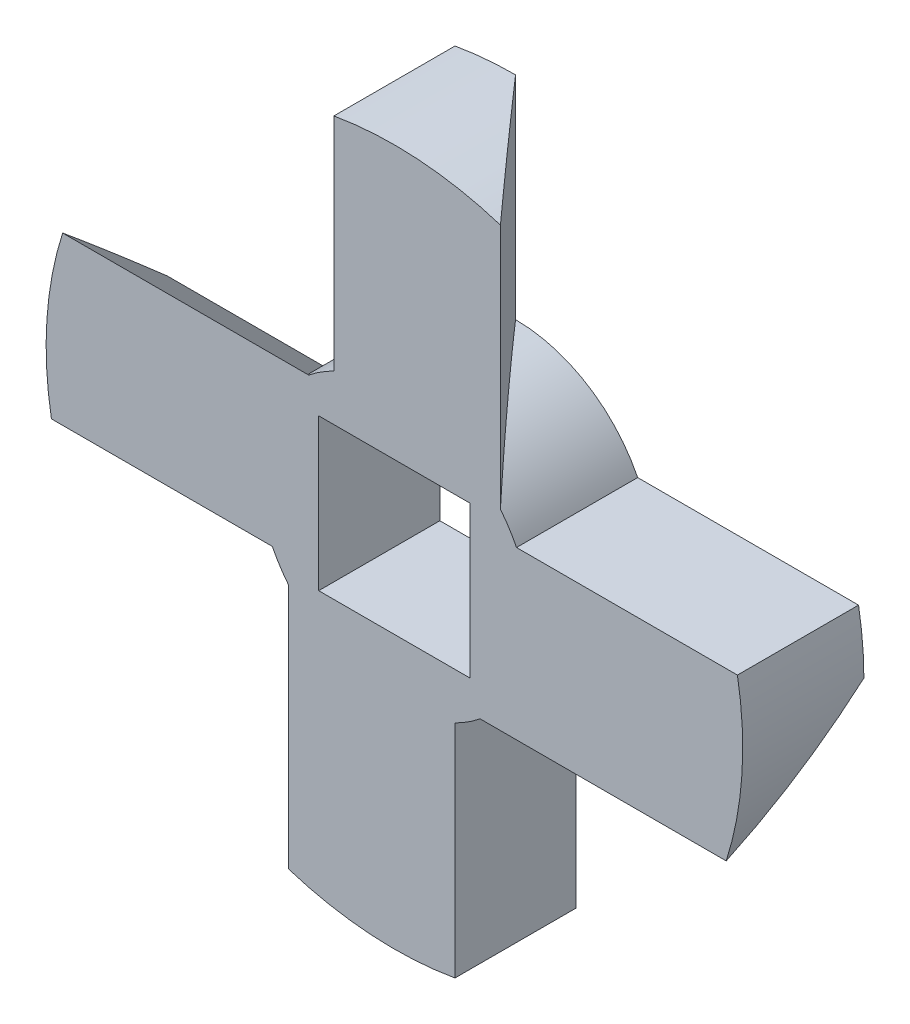
from build123d import *

# Parameters (mm, degrees)
SKETCH1_R               = 9
SKETCH1_W               = 10
SKETCH1_H               = 10
BOSS_EXTRUDE1_DEPTH     = 4
BOSS_EXTRUDE2_START     = -28
BOSS_EXTRUDE2_DEPTH     = 31.343146
CIRPATTERN1_START       = -37
CIRPATTERN1_DEPTH       = 31.343145751
CIRPATTERN1_START_2     = 5.656854249
CIRPATTERN1_2_DEPTH     = 31.343145751
CIRPATTERN1_3_OUTLINE_W = 28
CIRPATTERN1_3_OUTLINE_H = 8
CIRPATTERN1_3_DEPTH     = 4
CIRPATTERN1_START_3     = -4
CIRPATTERN1_4_DEPTH     = 8
CIRPATTERN1_START_4     = 9
CIRPATTERN1_5_DEPTH     = 28
CUT_EXTRUDE1_START      = -4
SKETCH7_R               = 40
SKETCH7_R_2             = 23
CUT_EXTRUDE1_DEPTH      = 8
BOSS_EXTRUDE3_REACH     = 41.611


with BuildPart() as part:
    # Sketch1 → Boss-Extrude1 (new, symmetric)
    with BuildSketch(Plane.XY):
        Circle(SKETCH1_R)
        Rectangle(SKETCH1_W, SKETCH1_H, mode=Mode.SUBTRACT)
    extrude(amount=BOSS_EXTRUDE1_DEPTH, both=True)

    # Sketch4 → Boss-Extrude2 (add)
    with BuildSketch(Plane(origin=(-9, 0, 0), x_dir=(0, 0, -1), z_dir=(1, 0, 0)).offset(BOSS_EXTRUDE2_START)):
        Polygon((4, 0), (4, -4), (-4, -4), (-4, 7), align=None)
    extrude(amount=BOSS_EXTRUDE2_DEPTH)

    # CirPattern1: read off the stored shape, not the designer's step
    # CirPattern1 outline → CirPattern1 (add)
    with BuildSketch(Plane(origin=(0, 0, 0), x_dir=(1, 0, 0), z_dir=(0, 1, 0)).offset(CIRPATTERN1_START)):
        Polygon((-7, -4), (4, -4), (4, 4), (0, 4), align=None)
    extrude(amount=CIRPATTERN1_DEPTH)

    # CirPattern1 2 outline → CirPattern1 2 (add)
    with BuildSketch(Plane(origin=(0, 0, 0), x_dir=(1, 0, 0), z_dir=(0, 1, 0)).offset(CIRPATTERN1_START_2)):
        Polygon((-4, -4), (7, -4), (0, 4), (-4, 4), align=None)
    extrude(amount=CIRPATTERN1_2_DEPTH)

    # CirPattern1 3 outline → CirPattern1 3 (add)
    with BuildSketch(Plane(origin=(0, 0, 0), x_dir=(1, 0, 0), z_dir=(0, 1, 0))):
        with Locations((23, 0)):
            Rectangle(CIRPATTERN1_3_OUTLINE_W, CIRPATTERN1_3_OUTLINE_H)
    extrude(amount=CIRPATTERN1_3_DEPTH)

    # CirPattern1 4 outline → CirPattern1 4 (add)
    with BuildSketch(Plane.XY.offset(CIRPATTERN1_START_3)):
        with BuildLine():
            ThreePointArc((8.062257749, 4), (8.76242888, 2.054224947), (9, 0))
            Line((9, 0), (9, 4))
            Line((9, 4), (8.062257749, 4))
        make_face()
    extrude(amount=CIRPATTERN1_4_DEPTH)

    # CirPattern1 5 outline → CirPattern1 5 (add)
    with BuildSketch(Plane.YZ.offset(CIRPATTERN1_START_4)):
        Polygon((0, -4), (0, 4), (-7, 4), align=None)
    extrude(amount=CIRPATTERN1_5_DEPTH)

    # Sketch7 → Cut-Extrude1 (cut)
    with BuildSketch(Plane.XY.offset(CUT_EXTRUDE1_START)):
        Circle(SKETCH7_R)
        Circle(SKETCH7_R_2, mode=Mode.SUBTRACT)
    extrude(amount=CUT_EXTRUDE1_DEPTH, mode=Mode.SUBTRACT)

    # Sketch8 → Boss-Extrude3 (add, up to next)
    with BuildSketch(Plane.ZY.offset(-9), mode=Mode.PRIVATE) as boss_extrude3_sk1:
        Polygon((4, -7), (4, 0), (-4, 0), align=None)
    boss_extrude3_tool1 = extrude(boss_extrude3_sk1.sketch, amount=BOSS_EXTRUDE3_REACH, mode=Mode.PRIVATE) - part.part
    add(boss_extrude3_tool1.solids().sort_by_distance((9, -2.333333, 1.333333))[0])


solid = part.part
